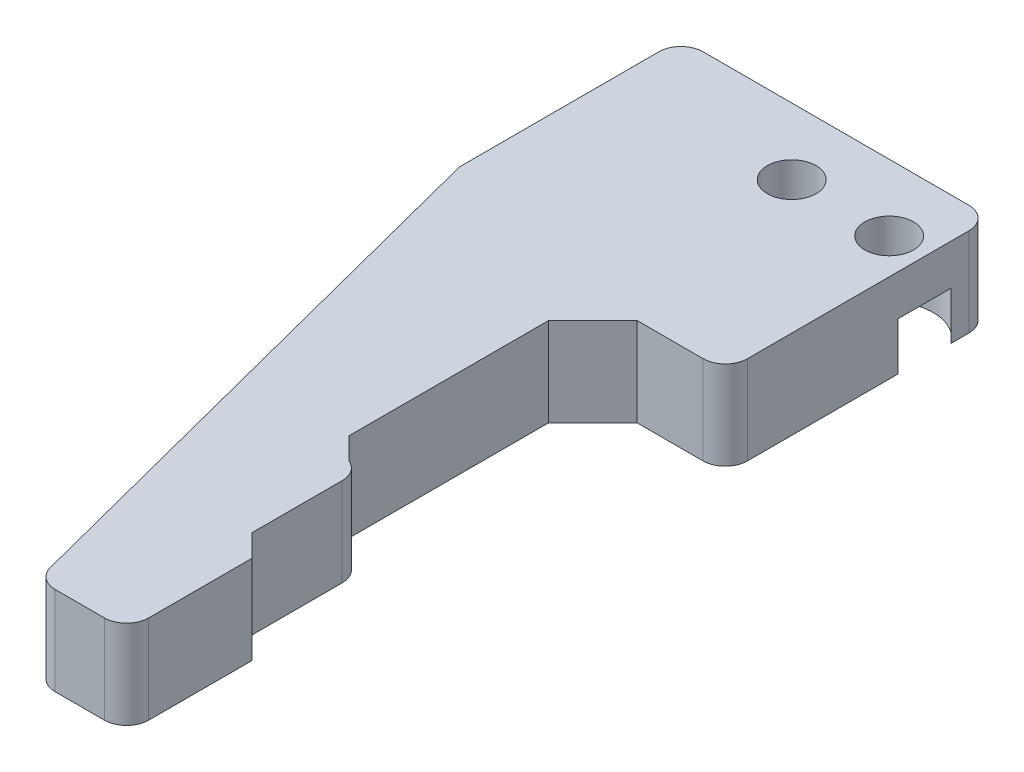
from build123d import *

# Parameters (mm, degrees)
BOSS_EXTRUDE1_DEPTH                                 = 10
CHAMFER1_SIZE                                       = 5
CHAMFER2_SIZE                                       = 2.5
FILLET1_R                                           = 2.5
CBORE_FOR_M5_HEX_SOCKET_HEAD_CAP_SCREW5_D           = 5.5
CBORE_FOR_M5_HEX_SOCKET_HEAD_CAP_SCREW5_DEPTH       = 10
CBORE_FOR_M5_HEX_SOCKET_HEAD_CAP_SCREW5_CBORE_D     = 10
CBORE_FOR_M5_HEX_SOCKET_HEAD_CAP_SCREW5_CBORE_DEPTH = 5.4
CBORE_FOR_M5_HEX_SOCKET_HEAD_CAP_SCREW5_TIP         = 1.652366702


# Some blends are built 0.0001 mm under size
with BuildPart() as part:
    # Sketch2 → Boss-Extrude1 (new body)
    with BuildSketch(Plane(origin=(0, 0, 0), x_dir=(1, 0, 0), z_dir=(0, 1, 0))):
        Polygon((0, 59.135462652), (-14.95, 59.135462652), (-14.95, 29.135462652), (-10.95, 29.135462652), (-10.95, 14.135462652), (-8.45, 14.135462652), (-8.45, 0), (-18.45, 0), (-35, 64.135462652), (-35, 89.135462652), (0, 89.135462652), align=None)
    extrude(amount=BOSS_EXTRUDE1_DEPTH)

    # Chamfer1
    chamfer1_edges = [part.edges().sort_by_distance(p)[0] for p in [
        (-14.95, 5, -59.135462652),
    ]]
    chamfer(chamfer1_edges, length=CHAMFER1_SIZE)

    # Chamfer2
    chamfer2_edges = [part.edges().sort_by_distance(p)[0] for p in [
        (-10.95, 5, -14.135462652),
        (-14.95, 5, -29.135462652),
    ]]
    chamfer(chamfer2_edges, length=CHAMFER2_SIZE - 0.0001)  # a hair under: the kernel refuses the full size

    # Fillet1
    # the kernel refuses this fillet: 2.5 mm, written as the material it takes off along each edge
    with BuildSketch(Plane(origin=(0, -6.25, -89.135462652), x_dir=(0, 0, 1), z_dir=(0, 1, 0)), Plane(origin=(-35, -6.25, -89.135462652), x_dir=(1, 0, 0), z_dir=(0, 1, 0)), Plane(origin=(0, -6.25, -59.135462652), x_dir=(-1, 0, 0), z_dir=(0, 1, 0))) as fillet1_piece_1:
        with BuildLine():
            CenterArc((FILLET1_R, -FILLET1_R), FILLET1_R, 90, 90)
            Line((0, -FILLET1_R), (-FILLET1_R * 0.02, -FILLET1_R))
            Line((-FILLET1_R * 0.02, -FILLET1_R), (-FILLET1_R * 0.02, FILLET1_R * 0.02))
            Line((-FILLET1_R * 0.02, FILLET1_R * 0.02), (FILLET1_R, FILLET1_R * 0.02))
            Line((FILLET1_R, FILLET1_R * 0.02), (FILLET1_R, 0))
        make_face()
    extrude(amount=22.5, mode=Mode.SUBTRACT)
    with BuildSketch(Plane(origin=(-8.45, -6.25, 0), x_dir=(0, 0, -1), z_dir=(0, 1, 0))) as fillet1_piece_2:
        with BuildLine():
            CenterArc((FILLET1_R, FILLET1_R), FILLET1_R, 180, 90)
            Line((0, FILLET1_R), (-FILLET1_R * 0.02, FILLET1_R))
            Line((-FILLET1_R * 0.02, FILLET1_R), (-FILLET1_R * 0.02, -FILLET1_R * 0.02))
            Line((-FILLET1_R * 0.02, -FILLET1_R * 0.02), (FILLET1_R, -FILLET1_R * 0.02))
            Line((FILLET1_R, -FILLET1_R * 0.02), (FILLET1_R, 0))
        make_face()
    extrude(amount=22.5, mode=Mode.SUBTRACT)
    with BuildSketch(Plane(origin=(-18.45, -4.84193858, 0), x_dir=(-0.24986263082994187, 0, -0.9682812947252158), z_dir=(0, 1, 0))) as fillet1_piece_3:
        with BuildLine():
            CenterArc((FILLET1_R * 0.774710172815, -FILLET1_R), FILLET1_R, 90, 75.530616462)
            Line((-FILLET1_R * 0.19357112191, -FILLET1_R * 0.75013736917), (-FILLET1_R * 0.212936747805, -FILLET1_R * 0.745140116553))
            Line((-FILLET1_R * 0.212936747805, -FILLET1_R * 0.745140116553), (-FILLET1_R * 0.0154942034563, FILLET1_R * 0.02))
            Line((-FILLET1_R * 0.0154942034563, FILLET1_R * 0.02), (FILLET1_R * 0.774710172815, FILLET1_R * 0.02))
            Line((FILLET1_R * 0.774710172815, FILLET1_R * 0.02), (FILLET1_R * 0.774710172815, 0))
        make_face()
    extrude(amount=19.68387716, mode=Mode.SUBTRACT)
    with BuildSketch(Plane(origin=(-10.95, -5.728328721, -29.135462652), x_dir=(-1, 0, 0), z_dir=(0, 1, 0))) as fillet1_piece_4:
        with BuildLine():
            CenterArc((2.5, 2.291331488), FILLET1_R, 180, 66.424322091)
            Line((0, 2.291331488), (-0.05, 2.291331488))
            Line((-0.05, 2.291331488), (-0.05, 0))
            Line((-0.05, 0), (0, -0.05))
            ThreePointArc((0, -0.05), (0.75005, -0.05), (1.480102, -0.04582663))
            Line((1.480102, -0.04582663), (1.5001, 0))
        make_face()
    extrude(amount=21.456657442, mode=Mode.SUBTRACT)

    # CBORE for M5 Hex Socket Head Cap Screw5
    with Locations(Plane(origin=(0, 0, 0), x_dir=(-1, 0, 0), z_dir=(0, -1, 0))):
        with Locations((4, 81.635462652), (15, 81.635462652)):
            CounterBoreHole(CBORE_FOR_M5_HEX_SOCKET_HEAD_CAP_SCREW5_D / 2, CBORE_FOR_M5_HEX_SOCKET_HEAD_CAP_SCREW5_CBORE_D / 2, CBORE_FOR_M5_HEX_SOCKET_HEAD_CAP_SCREW5_CBORE_DEPTH, depth=CBORE_FOR_M5_HEX_SOCKET_HEAD_CAP_SCREW5_DEPTH)
            with Locations((0, 0, -(CBORE_FOR_M5_HEX_SOCKET_HEAD_CAP_SCREW5_DEPTH + CBORE_FOR_M5_HEX_SOCKET_HEAD_CAP_SCREW5_TIP / 2))):  # 118° drill point
                Cone(0, CBORE_FOR_M5_HEX_SOCKET_HEAD_CAP_SCREW5_D / 2, CBORE_FOR_M5_HEX_SOCKET_HEAD_CAP_SCREW5_TIP, mode=Mode.SUBTRACT)


solid = part.part
